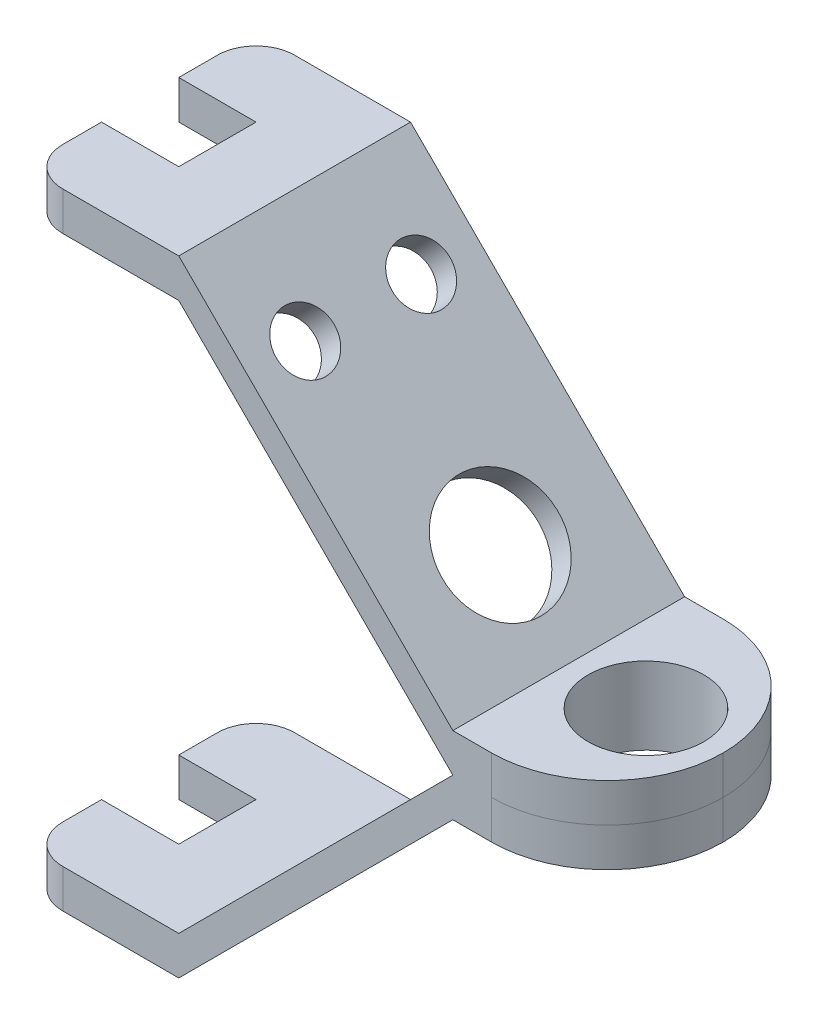
from build123d import *

# Parameters (mm, degrees)
SALIENTE_EXTRUIR1_DEPTH    = 60
CROQUIS3_W                 = 40
CROQUIS3_H                 = 20
CORTAR_EXTRUIR1_DEPTH      = 46
CROQUIS4_R                 = 15
CORTAR_EXTRUIR5_DEPTH      = 57
CORTAR_EXTRUIR6_DEPTH      = 16
CORTAR_EXTRUIR6_DEPTH_BACK = 19
CROQUIS12_R                = 7.5
CROQUIS12_R_2              = 15
REDONDEO2_R                = 10
REDONDEO3_R                = 30
CROQUIS13_R                = 15
CORTAR_EXTRUIR7_DEPTH      = 82
REDONDEO4_R                = 30
CROQUIS14_W                = 20
CROQUIS14_H                = 20
CORTAR_EXTRUIR8_DEPTH      = 156
CORTAR_EXTRUIR9_DEPTH      = 37
CORTAR_EXTRUIR9_DEPTH_BACK = 54
CROQUIS16_R                = 7.5
CROQUIS16_R_2              = 15
REDONDEO5_R                = 10


with BuildPart() as part:
    # Croquis2 → Saliente-Extruir1 (new body)
    with BuildSketch(Plane.XY):
        Polygon((-36.180131723, 22.907142857), (3.819868277, 22.907142857), (74.767829948, -48.040818814), (114.767829948, -48.040818814), (114.767829948, -38.040818814), (74.767829948, -38.040818814), (3.819868277, 32.907142857), (-36.180131723, 32.907142857), align=None)
    saliente_extruir1 = extrude(amount=SALIENTE_EXTRUIR1_DEPTH)

    # Croquis3 → Cortar-Extruir1 (cut)
    with BuildSketch(Plane(origin=(0, 0, 0), x_dir=(1, 0, 0), z_dir=(0, 1, 0))):
        with Locations((-36.180131723, -30)):
            Rectangle(CROQUIS3_W, CROQUIS3_H)
    extrude(amount=CORTAR_EXTRUIR1_DEPTH, mode=Mode.SUBTRACT)

    # Croquis4 → Cortar-Extruir5 (cut)
    with BuildSketch(Plane(origin=(0, 0, 0), x_dir=(1, 0, 0), z_dir=(0, 1, 0))):
        with Locations(Location((94.767829948, -30, 0), (0, 0, 270))):
            Circle(CROQUIS4_R)
    extrude(amount=-CORTAR_EXTRUIR5_DEPTH, mode=Mode.SUBTRACT)

    # Croquis12 → Cortar-Extruir6 (cut, two sides: drawn at the far end of the back side and taken through both)
    with BuildSketch(Plane(origin=(18.363505567, 18.363505567, 0), x_dir=(0, 0, -1), z_dir=(0.7071067811865486, 0.7071067811865465, 0)).offset(-CORTAR_EXTRUIR6_DEPTH_BACK)):
        with Locations(Location((-15, -4.516083302, 0), (0, 0, 270))):
            Circle(CROQUIS12_R)
        with Locations(Location((-45, -4.516083302, 0), (0, 0, 270))):
            Circle(CROQUIS12_R)
        with Locations(Location((-30, -54.683868112, 0), (0, 0, 270))):
            Circle(CROQUIS12_R_2)
    extrude(amount=CORTAR_EXTRUIR6_DEPTH + CORTAR_EXTRUIR6_DEPTH_BACK, mode=Mode.SUBTRACT)

    # Redondeo2
    redondeo2_edges = [part.edges().sort_by_distance(p)[0] for p in [
        (-36.180131723, 27.907142857, 0),
        (-36.180131723, 27.907142857, 60),
    ]]
    fillet(redondeo2_edges, radius=REDONDEO2_R)

    # Redondeo3
    redondeo3_edges = [part.edges().sort_by_distance(p)[0] for p in [
        (114.767829948, -43.040818814, 60),
        (114.767829948, -43.040818814, 0),
    ]]
    fillet(redondeo3_edges, radius=REDONDEO3_R - 0.0001)  # a hair under: the kernel refuses the full size

    # Simetría1: Saliente-Extruir1 across plane
    add(saliente_extruir1.mirror(Plane(origin=(114.767829948, -48.040818814, 60), x_dir=(0, 0, 1), z_dir=(0, 1, 0))))

    # Croquis13 → Cortar-Extruir7 (cut)
    with BuildSketch(Plane(origin=(0, 0, 0), x_dir=(1, 0, 0), z_dir=(0, 1, 0))):
        with Locations((94.767829948, -30)):
            Circle(CROQUIS13_R)
    extrude(amount=-CORTAR_EXTRUIR7_DEPTH, mode=Mode.SUBTRACT)

    # Redondeo4
    redondeo4_edges = [part.edges().sort_by_distance(p)[0] for p in [
        (114.767829948, -53.040818814, 0),
        (114.767829948, -53.040818814, 60),
    ]]
    fillet(redondeo4_edges, radius=REDONDEO4_R - 0.0001)  # a hair under: the kernel refuses the full size

    # Croquis14 → Cortar-Extruir8 (cut)
    with BuildSketch(Plane(origin=(0, 0, 0), x_dir=(1, 0, 0), z_dir=(0, 1, 0))):
        with Locations((-26.180131723, -30)):
            Rectangle(CROQUIS14_W, CROQUIS14_H)
    extrude(amount=-CORTAR_EXTRUIR8_DEPTH, mode=Mode.SUBTRACT)

    # Croquis16 → Cortar-Extruir9 (cut, two sides: drawn at the far end of the back side and taken through both)
    with BuildSketch(Plane(origin=(66.404324381, -66.404324381, 0), x_dir=(0, 0, -1), z_dir=(0.7071067811865486, -0.7071067811865465, 0)).offset(-CORTAR_EXTRUIR9_DEPTH_BACK)):
        with Locations(Location((-45, -63.423894212, 0), (0, 0, 270))):
            Circle(CROQUIS16_R)
        with Locations(Location((-15, -63.423894212, 0), (0, 0, 270))):
            Circle(CROQUIS16_R)
        with Locations(Location((-30, -13.256109403, 0), (0, 0, 270))):
            Circle(CROQUIS16_R_2)
    extrude(amount=CORTAR_EXTRUIR9_DEPTH + CORTAR_EXTRUIR9_DEPTH_BACK, mode=Mode.SUBTRACT)

    # Redondeo5
    redondeo5_edges = [part.edges().sort_by_distance(p)[0] for p in [
        (-36.180131723, -123.988780485, 60),
        (-36.180131723, -123.988780485, 0),
    ]]
    fillet(redondeo5_edges, radius=REDONDEO5_R)


solid = part.part
